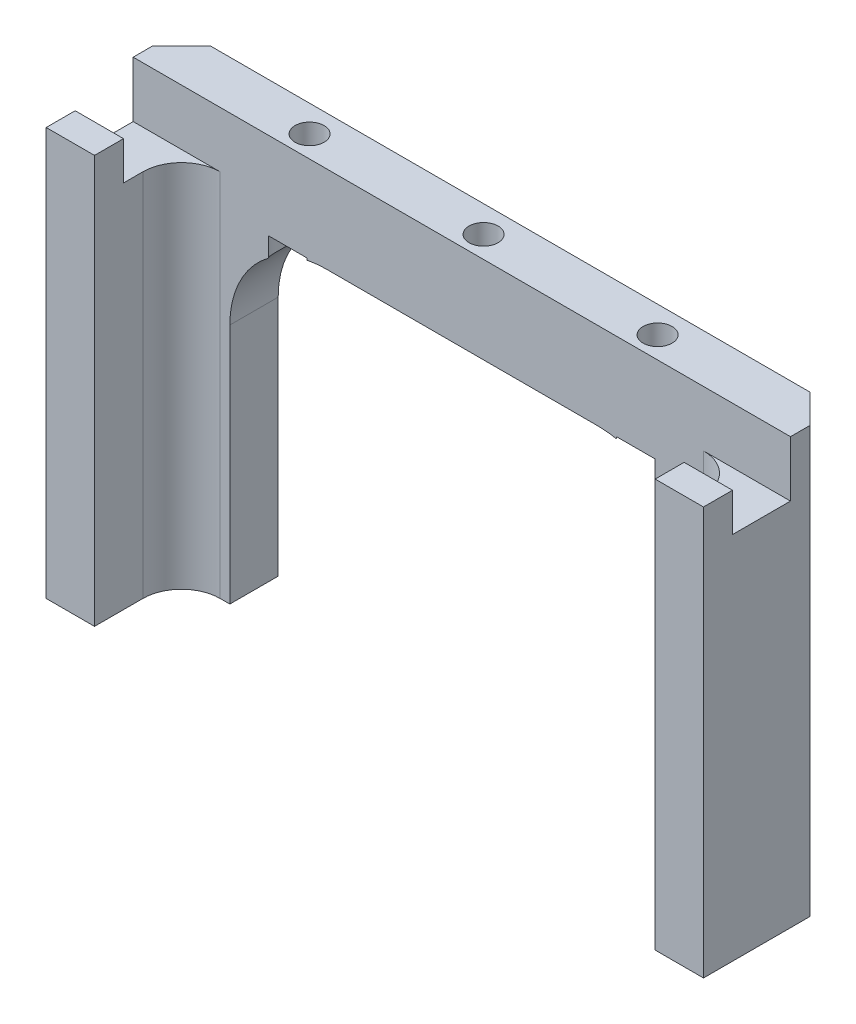
from build123d import *

# Parameters (mm, degrees)
BOSS_EXTRUDE1_DEPTH     = 44
SKETCH2_W               = 48
SKETCH2_H               = 35
CUT_EXTRUDE1_DEPTH      = 58.341084747
FILLET1_R               = 10
CUT_EXTRUDE2_DEPTH      = 51.764160586
CUT_EXTRUDE2_DEPTH_BACK = 51.764160586
SKETCH3_R               = 1.5
CHAMFER1_SIZE           = 3
CUT_EXTRUDE3_DEPTH      = 58.341084747
CUT_EXTRUDE3_DEPTH_BACK = 58.341084747
SKETCH4_W               = 9
SKETCH4_H               = 1.8
CUT_EXTRUDE4_DEPTH      = 58.341084747
CUT_EXTRUDE4_DEPTH_BACK = 58.341084747
SKETCH5_W               = 6
SKETCH5_H               = 3.971430967
SKETCH6_R               = 3
CUT_EXTRUDE6_DEPTH      = 11
FILLET2_R               = 4


with BuildPart() as part:
    # Sketch1 → Boss-Extrude1 (new body)
    with BuildSketch(Plane(origin=(0, 0, 0), x_dir=(1, 0, 0), z_dir=(0, 1, 0))):
        Polygon((34, 0), (-34, 0), (-34, -14), (-29, -14), (-29, -5), (29, -5), (29, -14), (34, -14), align=None)
    extrude(amount=-BOSS_EXTRUDE1_DEPTH)

    # Sketch2 → Cut-Extrude1 (cut, through all)
    with BuildSketch(Plane(origin=(0, 0, 0), x_dir=(-1, 0, 0), z_dir=(0, 0, -1))):
        with Locations((0, -26.5)):
            Rectangle(SKETCH2_W, SKETCH2_H)
    extrude(amount=-CUT_EXTRUDE1_DEPTH, mode=Mode.SUBTRACT)

    # Fillet1
    fillet1_edges = [part.edges().sort_by_distance(p)[0] for p in [
        (24, -9, 2.5),
        (-24, -9, 2.5),
    ]]
    fillet(fillet1_edges, radius=FILLET1_R)

    # Sketch3 → Cut-Extrude2 (cut, two sides: drawn at the far end of the back side and taken through both)
    with BuildSketch(Plane.XZ.offset(9).offset(-CUT_EXTRUDE2_DEPTH_BACK)):
        with Locations((0, 2.75)):
            Circle(SKETCH3_R)
        with Locations((-18, 2.75)):
            Circle(SKETCH3_R)
        with Locations((18, 2.75)):
            Circle(SKETCH3_R)
    extrude(amount=CUT_EXTRUDE2_DEPTH + CUT_EXTRUDE2_DEPTH_BACK, mode=Mode.SUBTRACT)

    # Chamfer1
    chamfer1_edges = [part.edges().sort_by_distance(p)[0] for p in [
        (-34, -22, 0),
        (34, -22, 0),
    ]]
    chamfer(chamfer1_edges, length=CHAMFER1_SIZE)

    # Sketch4 → Cut-Extrude3 (cut, two sides: drawn at the far end of the back side and taken through both)
    with BuildSketch(Plane(origin=(0, 0, 0), x_dir=(0, 0, -1), z_dir=(1, 0, 0)).offset(-CUT_EXTRUDE3_DEPTH_BACK)):
        with Locations((-9.5, -0.9)):
            Rectangle(SKETCH4_W, SKETCH4_H)
    extrude(amount=CUT_EXTRUDE3_DEPTH + CUT_EXTRUDE3_DEPTH_BACK, mode=Mode.SUBTRACT)

    # Sketch5 → Cut-Extrude4 (cut, two sides: drawn at the far end of the back side and taken through both)
    with BuildSketch(Plane(origin=(0, 0, 0), x_dir=(0, 0, -1), z_dir=(1, 0, 0)).offset(-CUT_EXTRUDE4_DEPTH_BACK)):
        with Locations((-8, -3.785715484)):
            Rectangle(SKETCH5_W, SKETCH5_H)
    extrude(amount=CUT_EXTRUDE4_DEPTH + CUT_EXTRUDE4_DEPTH_BACK, mode=Mode.SUBTRACT)

    # Sketch6 → Cut-Extrude6 (cut)
    with BuildSketch(Plane.XZ.offset(9)):
        with Locations((0, 2.75)):
            Circle(SKETCH6_R)
        with Locations((18, 2.75)):
            Circle(SKETCH6_R)
        with Locations((-18, 2.75)):
            Circle(SKETCH6_R)
    extrude(amount=CUT_EXTRUDE6_DEPTH, mode=Mode.SUBTRACT)

    # Fillet2
    fillet2_edges = [part.edges().sort_by_distance(p)[0] for p in [
        (29, -24.885715483, 5),
        (-29, -24.885715483, 5),
    ]]
    fillet(fillet2_edges, radius=FILLET2_R)


solid = part.part
